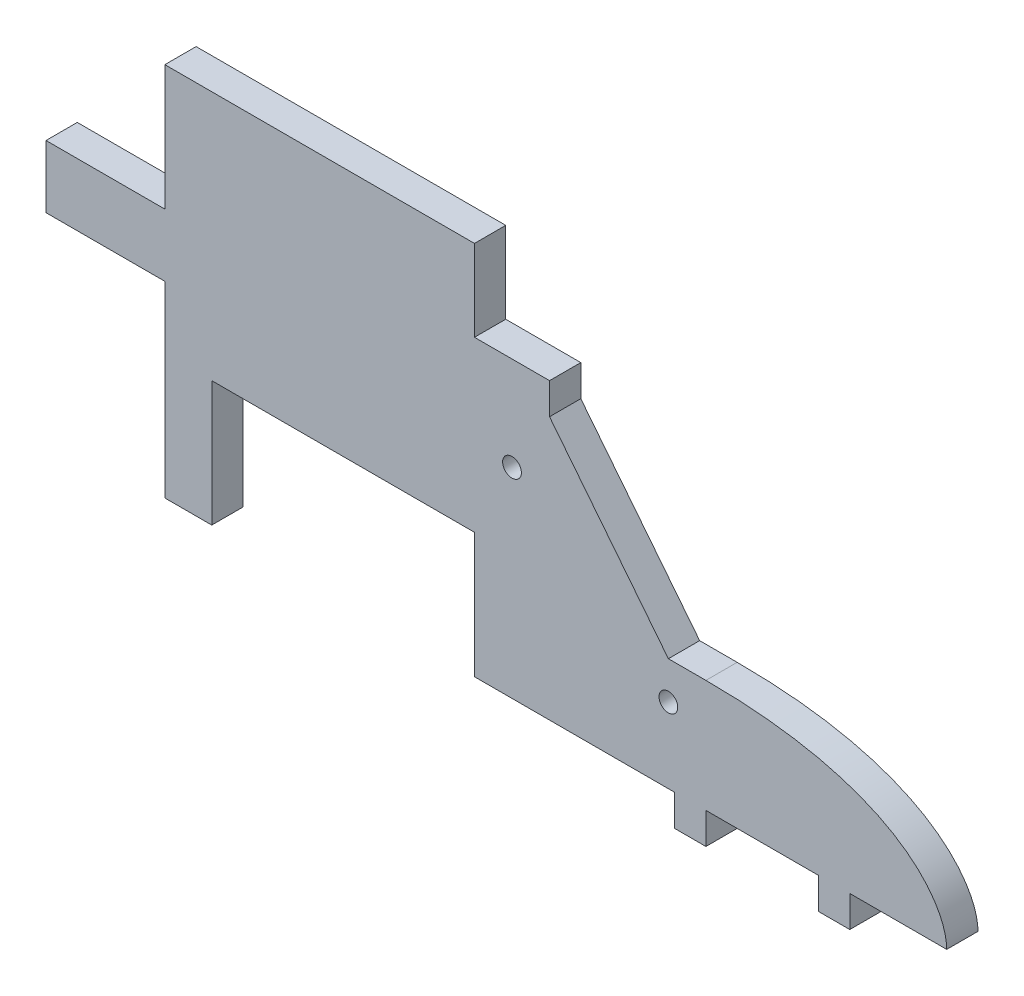
from build123d import *

# Parameters (mm, degrees)
ESQUISSE1_R             = 1.5
BOSS_EXTRU_1_DEPTH      = 5
BOSS_EXTRU_2_DEPTH      = 5
ESQUISSE3_W             = 236.288260714
ESQUISSE3_H             = 122.224262112
ENL_V_MAT_EXTRU_1_DEPTH = 5


with BuildPart() as part:
    # Esquisse1 → Boss.-Extru.1 (new body)
    with BuildSketch(Plane.XY):
        Polygon((12, 42), (31, 18), (37, 18), (37, 0), (37, -5), (32, -5), (32, 0), (0, 0), (0, 47), (12, 47), align=None)
        with Locations((6, 32)):
            Circle(ESQUISSE1_R, mode=Mode.SUBTRACT)
        with Locations((31, 12)):
            Circle(ESQUISSE1_R, mode=Mode.SUBTRACT)
    extrude(amount=BOSS_EXTRU_1_DEPTH)

    # Esquisse2 → Boss.-Extru.2 (add)
    with BuildSketch(Plane(origin=(0, 0, 0), x_dir=(-1, 0, 0), z_dir=(0, 0, -1))):
        with BuildLine():
            Line((-37, 0), (-55, 0))
            Line((-55, 0), (-55, -5))
            Line((-55, -5), (-60, -5))
            Line((-60, -5), (-60, 0))
            Line((-60, 0), (-75.5, 0))
            add(Edge.make_bspline(
                [(-75.5, 0), (-75.5, 5.982232529), (-67.685409636, 18), (-37, 18)],
                knots=[0, 0, 0, 0, 1, 1, 1, 1], degree=3))
            Line((-37, 18), (-37, 0))
        make_face()
        Polygon((42, 0), (49.5, 0), (49.5, 30), (68.5, 30), (68.5, 40), (49.5, 40), (49.5, 110), (68.5, 110), (68.5, 120), (49.5, 120), (49.5, 142), (-1, 142), (-1, 167), (-10, 167), (-10, 172), (-20, 172), (-20, 167), (-25, 167), (-25, 90), (20, 90), (20, 60), (0, 60), (0, 20), (42, 20), align=None)
    extrude(amount=-BOSS_EXTRU_2_DEPTH)

    # Esquisse3 → Enlèv. mat.-Extru.1 (cut)
    with BuildSketch(Plane(origin=(0, 0, 0), x_dir=(-1, 0, 0), z_dir=(0, 0, -1))):
        with Locations((68.98963671, 121.112131056)):
            Rectangle(ESQUISSE3_W, ESQUISSE3_H)
    extrude(amount=-ENL_V_MAT_EXTRU_1_DEPTH, mode=Mode.SUBTRACT)


solid = part.part
